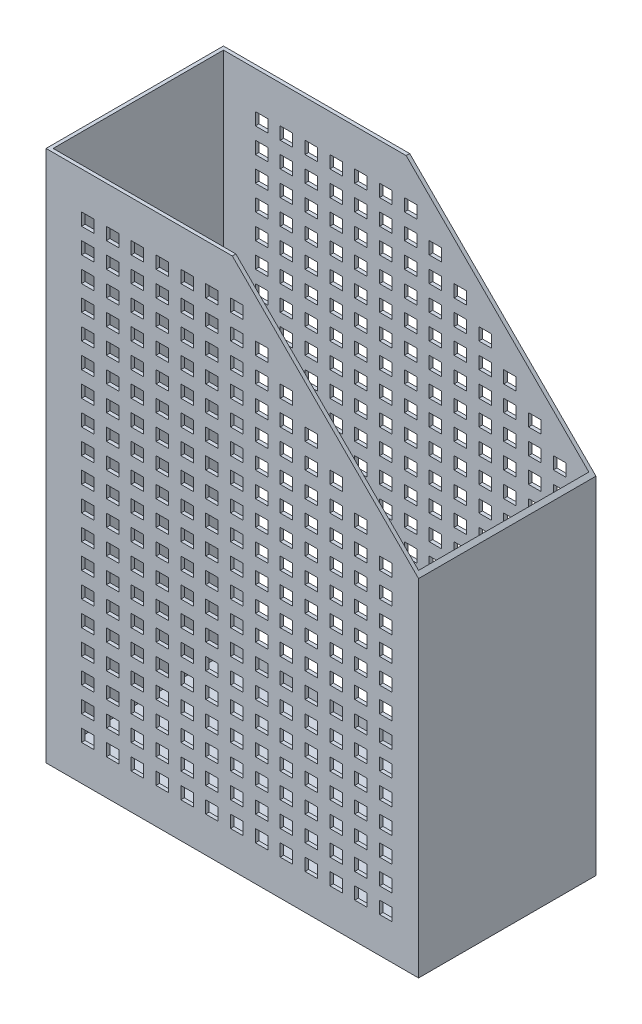
from build123d import *

# Parameters (mm, degrees)
SKETCH1_W                 = 210
SKETCH1_H                 = 100
BOSS_EXTRUDE1_DEPTH       = 300
CUT_EXTRUDE1_DEPTH        = 300
SHELL1_T                  = -2
SHELL1_THICKNESS_2_FACE_W = 96
SHELL1_THICKNESS_2_FACE_H = 206
SHELL1_THICKNESS_2_DEPTH  = 3
SKETCH3_W                 = 7
SKETCH3_H                 = 7
CUT_EXTRUDE3_DEPTH        = 300


with BuildPart() as part:
    # Sketch1 → Boss-Extrude1 (new body)
    with BuildSketch(Plane(origin=(0, 0, 0), x_dir=(1, 0, 0), z_dir=(0, 1, 0))):
        with Locations((105, 50)):
            Rectangle(SKETCH1_W, SKETCH1_H)
    extrude(amount=BOSS_EXTRUDE1_DEPTH)

    # Sketch2 → Cut-Extrude1 (cut)
    with BuildSketch(Plane.XY):
        Polygon((210, 300), (105, 300), (210, 195), align=None)
    extrude(amount=-CUT_EXTRUDE1_DEPTH, mode=Mode.SUBTRACT)

    # Shell1
    shell1_openings = [part.faces().sort_by_distance(p)[0] for p in [
        (52.5, 300, -50),
        (157.5, 247.5, -50),
    ]]
    offset(amount=SHELL1_T, openings=shell1_openings, kind=Kind.INTERSECTION)

    # Shell1 thickness 2 face (on inner face of the shell) → Shell1 thickness 2 (add)
    with BuildSketch(Plane(origin=(105, 2, -50), x_dir=(0, 0, -1), z_dir=(0, -1, 0))):
        Rectangle(SHELL1_THICKNESS_2_FACE_W, SHELL1_THICKNESS_2_FACE_H)
    extrude(amount=-SHELL1_THICKNESS_2_DEPTH)

    # Sketch3 → Cut-Extrude3 (cut)
    with BuildSketch(Plane.XY):
        with Locations((23.5, 23.5)):
            Rectangle(SKETCH3_W, SKETCH3_H)
        with Locations((37.5, 23.5)):
            Rectangle(SKETCH3_W, SKETCH3_H)
        with Locations((51.5, 23.5)):
            Rectangle(SKETCH3_W, SKETCH3_H)
        with Locations((65.5, 23.5)):
            Rectangle(SKETCH3_W, SKETCH3_H)
        with Locations((79.5, 23.5)):
            Rectangle(SKETCH3_W, SKETCH3_H)
        with Locations((93.5, 23.5)):
            Rectangle(SKETCH3_W, SKETCH3_H)
        with Locations((107.5, 23.5)):
            Rectangle(SKETCH3_W, SKETCH3_H)
        with Locations((121.5, 23.5)):
            Rectangle(SKETCH3_W, SKETCH3_H)
        with Locations((135.5, 23.5)):
            Rectangle(SKETCH3_W, SKETCH3_H)
        with Locations((149.5, 23.5)):
            Rectangle(SKETCH3_W, SKETCH3_H)
        with Locations((163.5, 23.5)):
            Rectangle(SKETCH3_W, SKETCH3_H)
        with Locations((177.5, 23.5)):
            Rectangle(SKETCH3_W, SKETCH3_H)
        with Locations((191.5, 23.5)):
            Rectangle(SKETCH3_W, SKETCH3_H)
        with Locations((37.5, 37.5)):
            Rectangle(SKETCH3_W, SKETCH3_H)
        with Locations((51.5, 37.5)):
            Rectangle(SKETCH3_W, SKETCH3_H)
        with Locations((65.5, 37.5)):
            Rectangle(SKETCH3_W, SKETCH3_H)
        with Locations((79.5, 37.5)):
            Rectangle(SKETCH3_W, SKETCH3_H)
        with Locations((93.5, 37.5)):
            Rectangle(SKETCH3_W, SKETCH3_H)
        with Locations((107.5, 37.5)):
            Rectangle(SKETCH3_W, SKETCH3_H)
        with Locations((121.5, 37.5)):
            Rectangle(SKETCH3_W, SKETCH3_H)
        with Locations((135.5, 37.5)):
            Rectangle(SKETCH3_W, SKETCH3_H)
        with Locations((149.5, 37.5)):
            Rectangle(SKETCH3_W, SKETCH3_H)
        with Locations((163.5, 37.5)):
            Rectangle(SKETCH3_W, SKETCH3_H)
        with Locations((177.5, 37.5)):
            Rectangle(SKETCH3_W, SKETCH3_H)
        with Locations((191.5, 37.5)):
            Rectangle(SKETCH3_W, SKETCH3_H)
        with Locations((37.5, 51.5)):
            Rectangle(SKETCH3_W, SKETCH3_H)
        with Locations((51.5, 51.5)):
            Rectangle(SKETCH3_W, SKETCH3_H)
        with Locations((65.5, 51.5)):
            Rectangle(SKETCH3_W, SKETCH3_H)
        with Locations((79.5, 51.5)):
            Rectangle(SKETCH3_W, SKETCH3_H)
        with Locations((93.5, 51.5)):
            Rectangle(SKETCH3_W, SKETCH3_H)
        with Locations((107.5, 51.5)):
            Rectangle(SKETCH3_W, SKETCH3_H)
        with Locations((121.5, 51.5)):
            Rectangle(SKETCH3_W, SKETCH3_H)
        with Locations((135.5, 51.5)):
            Rectangle(SKETCH3_W, SKETCH3_H)
        with Locations((149.5, 51.5)):
            Rectangle(SKETCH3_W, SKETCH3_H)
        with Locations((163.5, 51.5)):
            Rectangle(SKETCH3_W, SKETCH3_H)
        with Locations((177.5, 51.5)):
            Rectangle(SKETCH3_W, SKETCH3_H)
        with Locations((191.5, 51.5)):
            Rectangle(SKETCH3_W, SKETCH3_H)
        with Locations((37.5, 65.5)):
            Rectangle(SKETCH3_W, SKETCH3_H)
        with Locations((51.5, 65.5)):
            Rectangle(SKETCH3_W, SKETCH3_H)
        with Locations((65.5, 65.5)):
            Rectangle(SKETCH3_W, SKETCH3_H)
        with Locations((79.5, 65.5)):
            Rectangle(SKETCH3_W, SKETCH3_H)
        with Locations((93.5, 65.5)):
            Rectangle(SKETCH3_W, SKETCH3_H)
        with Locations((107.5, 65.5)):
            Rectangle(SKETCH3_W, SKETCH3_H)
        with Locations((121.5, 65.5)):
            Rectangle(SKETCH3_W, SKETCH3_H)
        with Locations((135.5, 65.5)):
            Rectangle(SKETCH3_W, SKETCH3_H)
        with Locations((149.5, 65.5)):
            Rectangle(SKETCH3_W, SKETCH3_H)
        with Locations((163.5, 65.5)):
            Rectangle(SKETCH3_W, SKETCH3_H)
        with Locations((177.5, 65.5)):
            Rectangle(SKETCH3_W, SKETCH3_H)
        with Locations((191.5, 65.5)):
            Rectangle(SKETCH3_W, SKETCH3_H)
        with Locations((37.5, 79.5)):
            Rectangle(SKETCH3_W, SKETCH3_H)
        with Locations((51.5, 79.5)):
            Rectangle(SKETCH3_W, SKETCH3_H)
        with Locations((65.5, 79.5)):
            Rectangle(SKETCH3_W, SKETCH3_H)
        with Locations((79.5, 79.5)):
            Rectangle(SKETCH3_W, SKETCH3_H)
        with Locations((93.5, 79.5)):
            Rectangle(SKETCH3_W, SKETCH3_H)
        with Locations((107.5, 79.5)):
            Rectangle(SKETCH3_W, SKETCH3_H)
        with Locations((121.5, 79.5)):
            Rectangle(SKETCH3_W, SKETCH3_H)
        with Locations((135.5, 79.5)):
            Rectangle(SKETCH3_W, SKETCH3_H)
        with Locations((149.5, 79.5)):
            Rectangle(SKETCH3_W, SKETCH3_H)
        with Locations((163.5, 79.5)):
            Rectangle(SKETCH3_W, SKETCH3_H)
        with Locations((177.5, 79.5)):
            Rectangle(SKETCH3_W, SKETCH3_H)
        with Locations((191.5, 79.5)):
            Rectangle(SKETCH3_W, SKETCH3_H)
        with Locations((37.5, 93.5)):
            Rectangle(SKETCH3_W, SKETCH3_H)
        with Locations((51.5, 93.5)):
            Rectangle(SKETCH3_W, SKETCH3_H)
        with Locations((65.5, 93.5)):
            Rectangle(SKETCH3_W, SKETCH3_H)
        with Locations((79.5, 93.5)):
            Rectangle(SKETCH3_W, SKETCH3_H)
        with Locations((93.5, 93.5)):
            Rectangle(SKETCH3_W, SKETCH3_H)
        with Locations((107.5, 93.5)):
            Rectangle(SKETCH3_W, SKETCH3_H)
        with Locations((121.5, 93.5)):
            Rectangle(SKETCH3_W, SKETCH3_H)
        with Locations((135.5, 93.5)):
            Rectangle(SKETCH3_W, SKETCH3_H)
        with Locations((149.5, 93.5)):
            Rectangle(SKETCH3_W, SKETCH3_H)
        with Locations((163.5, 93.5)):
            Rectangle(SKETCH3_W, SKETCH3_H)
        with Locations((177.5, 93.5)):
            Rectangle(SKETCH3_W, SKETCH3_H)
        with Locations((191.5, 93.5)):
            Rectangle(SKETCH3_W, SKETCH3_H)
        with Locations((37.5, 107.5)):
            Rectangle(SKETCH3_W, SKETCH3_H)
        with Locations((51.5, 107.5)):
            Rectangle(SKETCH3_W, SKETCH3_H)
        with Locations((65.5, 107.5)):
            Rectangle(SKETCH3_W, SKETCH3_H)
        with Locations((79.5, 107.5)):
            Rectangle(SKETCH3_W, SKETCH3_H)
        with Locations((93.5, 107.5)):
            Rectangle(SKETCH3_W, SKETCH3_H)
        with Locations((107.5, 107.5)):
            Rectangle(SKETCH3_W, SKETCH3_H)
        with Locations((121.5, 107.5)):
            Rectangle(SKETCH3_W, SKETCH3_H)
        with Locations((135.5, 107.5)):
            Rectangle(SKETCH3_W, SKETCH3_H)
        with Locations((149.5, 107.5)):
            Rectangle(SKETCH3_W, SKETCH3_H)
        with Locations((163.5, 107.5)):
            Rectangle(SKETCH3_W, SKETCH3_H)
        with Locations((177.5, 107.5)):
            Rectangle(SKETCH3_W, SKETCH3_H)
        with Locations((191.5, 107.5)):
            Rectangle(SKETCH3_W, SKETCH3_H)
        with Locations((37.5, 121.5)):
            Rectangle(SKETCH3_W, SKETCH3_H)
        with Locations((51.5, 121.5)):
            Rectangle(SKETCH3_W, SKETCH3_H)
        with Locations((65.5, 121.5)):
            Rectangle(SKETCH3_W, SKETCH3_H)
        with Locations((79.5, 121.5)):
            Rectangle(SKETCH3_W, SKETCH3_H)
        with Locations((93.5, 121.5)):
            Rectangle(SKETCH3_W, SKETCH3_H)
        with Locations((107.5, 121.5)):
            Rectangle(SKETCH3_W, SKETCH3_H)
        with Locations((121.5, 121.5)):
            Rectangle(SKETCH3_W, SKETCH3_H)
        with Locations((135.5, 121.5)):
            Rectangle(SKETCH3_W, SKETCH3_H)
        with Locations((149.5, 121.5)):
            Rectangle(SKETCH3_W, SKETCH3_H)
        with Locations((163.5, 121.5)):
            Rectangle(SKETCH3_W, SKETCH3_H)
        with Locations((177.5, 121.5)):
            Rectangle(SKETCH3_W, SKETCH3_H)
        with Locations((191.5, 121.5)):
            Rectangle(SKETCH3_W, SKETCH3_H)
        with Locations((37.5, 135.5)):
            Rectangle(SKETCH3_W, SKETCH3_H)
        with Locations((51.5, 135.5)):
            Rectangle(SKETCH3_W, SKETCH3_H)
        with Locations((65.5, 135.5)):
            Rectangle(SKETCH3_W, SKETCH3_H)
        with Locations((79.5, 135.5)):
            Rectangle(SKETCH3_W, SKETCH3_H)
        with Locations((93.5, 135.5)):
            Rectangle(SKETCH3_W, SKETCH3_H)
        with Locations((107.5, 135.5)):
            Rectangle(SKETCH3_W, SKETCH3_H)
        with Locations((121.5, 135.5)):
            Rectangle(SKETCH3_W, SKETCH3_H)
        with Locations((135.5, 135.5)):
            Rectangle(SKETCH3_W, SKETCH3_H)
        with Locations((149.5, 135.5)):
            Rectangle(SKETCH3_W, SKETCH3_H)
        with Locations((163.5, 135.5)):
            Rectangle(SKETCH3_W, SKETCH3_H)
        with Locations((177.5, 135.5)):
            Rectangle(SKETCH3_W, SKETCH3_H)
        with Locations((191.5, 135.5)):
            Rectangle(SKETCH3_W, SKETCH3_H)
        with Locations((37.5, 149.5)):
            Rectangle(SKETCH3_W, SKETCH3_H)
        with Locations((51.5, 149.5)):
            Rectangle(SKETCH3_W, SKETCH3_H)
        with Locations((65.5, 149.5)):
            Rectangle(SKETCH3_W, SKETCH3_H)
        with Locations((79.5, 149.5)):
            Rectangle(SKETCH3_W, SKETCH3_H)
        with Locations((93.5, 149.5)):
            Rectangle(SKETCH3_W, SKETCH3_H)
        with Locations((107.5, 149.5)):
            Rectangle(SKETCH3_W, SKETCH3_H)
        with Locations((121.5, 149.5)):
            Rectangle(SKETCH3_W, SKETCH3_H)
        with Locations((135.5, 149.5)):
            Rectangle(SKETCH3_W, SKETCH3_H)
        with Locations((149.5, 149.5)):
            Rectangle(SKETCH3_W, SKETCH3_H)
        with Locations((163.5, 149.5)):
            Rectangle(SKETCH3_W, SKETCH3_H)
        with Locations((177.5, 149.5)):
            Rectangle(SKETCH3_W, SKETCH3_H)
        with Locations((191.5, 149.5)):
            Rectangle(SKETCH3_W, SKETCH3_H)
        with Locations((37.5, 163.5)):
            Rectangle(SKETCH3_W, SKETCH3_H)
        with Locations((51.5, 163.5)):
            Rectangle(SKETCH3_W, SKETCH3_H)
        with Locations((65.5, 163.5)):
            Rectangle(SKETCH3_W, SKETCH3_H)
        with Locations((79.5, 163.5)):
            Rectangle(SKETCH3_W, SKETCH3_H)
        with Locations((93.5, 163.5)):
            Rectangle(SKETCH3_W, SKETCH3_H)
        with Locations((107.5, 163.5)):
            Rectangle(SKETCH3_W, SKETCH3_H)
        with Locations((121.5, 163.5)):
            Rectangle(SKETCH3_W, SKETCH3_H)
        with Locations((135.5, 163.5)):
            Rectangle(SKETCH3_W, SKETCH3_H)
        with Locations((149.5, 163.5)):
            Rectangle(SKETCH3_W, SKETCH3_H)
        with Locations((163.5, 163.5)):
            Rectangle(SKETCH3_W, SKETCH3_H)
        with Locations((177.5, 163.5)):
            Rectangle(SKETCH3_W, SKETCH3_H)
        with Locations((191.5, 163.5)):
            Rectangle(SKETCH3_W, SKETCH3_H)
        with Locations((37.5, 177.5)):
            Rectangle(SKETCH3_W, SKETCH3_H)
        with Locations((51.5, 177.5)):
            Rectangle(SKETCH3_W, SKETCH3_H)
        with Locations((65.5, 177.5)):
            Rectangle(SKETCH3_W, SKETCH3_H)
        with Locations((79.5, 177.5)):
            Rectangle(SKETCH3_W, SKETCH3_H)
        with Locations((93.5, 177.5)):
            Rectangle(SKETCH3_W, SKETCH3_H)
        with Locations((107.5, 177.5)):
            Rectangle(SKETCH3_W, SKETCH3_H)
        with Locations((121.5, 177.5)):
            Rectangle(SKETCH3_W, SKETCH3_H)
        with Locations((135.5, 177.5)):
            Rectangle(SKETCH3_W, SKETCH3_H)
        with Locations((149.5, 177.5)):
            Rectangle(SKETCH3_W, SKETCH3_H)
        with Locations((163.5, 177.5)):
            Rectangle(SKETCH3_W, SKETCH3_H)
        with Locations((177.5, 177.5)):
            Rectangle(SKETCH3_W, SKETCH3_H)
        with Locations((191.5, 177.5)):
            Rectangle(SKETCH3_W, SKETCH3_H)
        with Locations((37.5, 191.5)):
            Rectangle(SKETCH3_W, SKETCH3_H)
        with Locations((51.5, 191.5)):
            Rectangle(SKETCH3_W, SKETCH3_H)
        with Locations((65.5, 191.5)):
            Rectangle(SKETCH3_W, SKETCH3_H)
        with Locations((79.5, 191.5)):
            Rectangle(SKETCH3_W, SKETCH3_H)
        with Locations((93.5, 191.5)):
            Rectangle(SKETCH3_W, SKETCH3_H)
        with Locations((107.5, 191.5)):
            Rectangle(SKETCH3_W, SKETCH3_H)
        with Locations((121.5, 191.5)):
            Rectangle(SKETCH3_W, SKETCH3_H)
        with Locations((135.5, 191.5)):
            Rectangle(SKETCH3_W, SKETCH3_H)
        with Locations((149.5, 191.5)):
            Rectangle(SKETCH3_W, SKETCH3_H)
        with Locations((163.5, 191.5)):
            Rectangle(SKETCH3_W, SKETCH3_H)
        with Locations((177.5, 191.5)):
            Rectangle(SKETCH3_W, SKETCH3_H)
        with Locations((191.5, 191.5)):
            Rectangle(SKETCH3_W, SKETCH3_H)
        with Locations((37.5, 205.5)):
            Rectangle(SKETCH3_W, SKETCH3_H)
        with Locations((51.5, 205.5)):
            Rectangle(SKETCH3_W, SKETCH3_H)
        with Locations((65.5, 205.5)):
            Rectangle(SKETCH3_W, SKETCH3_H)
        with Locations((79.5, 205.5)):
            Rectangle(SKETCH3_W, SKETCH3_H)
        with Locations((93.5, 205.5)):
            Rectangle(SKETCH3_W, SKETCH3_H)
        with Locations((107.5, 205.5)):
            Rectangle(SKETCH3_W, SKETCH3_H)
        with Locations((121.5, 205.5)):
            Rectangle(SKETCH3_W, SKETCH3_H)
        with Locations((135.5, 205.5)):
            Rectangle(SKETCH3_W, SKETCH3_H)
        with Locations((149.5, 205.5)):
            Rectangle(SKETCH3_W, SKETCH3_H)
        with Locations((163.5, 205.5)):
            Rectangle(SKETCH3_W, SKETCH3_H)
        with Locations((177.5, 205.5)):
            Rectangle(SKETCH3_W, SKETCH3_H)
        with Locations((37.5, 219.5)):
            Rectangle(SKETCH3_W, SKETCH3_H)
        with Locations((51.5, 219.5)):
            Rectangle(SKETCH3_W, SKETCH3_H)
        with Locations((65.5, 219.5)):
            Rectangle(SKETCH3_W, SKETCH3_H)
        with Locations((79.5, 219.5)):
            Rectangle(SKETCH3_W, SKETCH3_H)
        with Locations((93.5, 219.5)):
            Rectangle(SKETCH3_W, SKETCH3_H)
        with Locations((107.5, 219.5)):
            Rectangle(SKETCH3_W, SKETCH3_H)
        with Locations((121.5, 219.5)):
            Rectangle(SKETCH3_W, SKETCH3_H)
        with Locations((135.5, 219.5)):
            Rectangle(SKETCH3_W, SKETCH3_H)
        with Locations((149.5, 219.5)):
            Rectangle(SKETCH3_W, SKETCH3_H)
        with Locations((163.5, 219.5)):
            Rectangle(SKETCH3_W, SKETCH3_H)
        with Locations((37.5, 233.5)):
            Rectangle(SKETCH3_W, SKETCH3_H)
        with Locations((51.5, 233.5)):
            Rectangle(SKETCH3_W, SKETCH3_H)
        with Locations((65.5, 233.5)):
            Rectangle(SKETCH3_W, SKETCH3_H)
        with Locations((79.5, 233.5)):
            Rectangle(SKETCH3_W, SKETCH3_H)
        with Locations((93.5, 233.5)):
            Rectangle(SKETCH3_W, SKETCH3_H)
        with Locations((107.5, 233.5)):
            Rectangle(SKETCH3_W, SKETCH3_H)
        with Locations((121.5, 233.5)):
            Rectangle(SKETCH3_W, SKETCH3_H)
        with Locations((135.5, 233.5)):
            Rectangle(SKETCH3_W, SKETCH3_H)
        with Locations((149.5, 233.5)):
            Rectangle(SKETCH3_W, SKETCH3_H)
        with Locations((191.5, 233.5)):
            Rectangle(SKETCH3_W, SKETCH3_H)
        with Locations((37.5, 247.5)):
            Rectangle(SKETCH3_W, SKETCH3_H)
        with Locations((51.5, 247.5)):
            Rectangle(SKETCH3_W, SKETCH3_H)
        with Locations((65.5, 247.5)):
            Rectangle(SKETCH3_W, SKETCH3_H)
        with Locations((79.5, 247.5)):
            Rectangle(SKETCH3_W, SKETCH3_H)
        with Locations((93.5, 247.5)):
            Rectangle(SKETCH3_W, SKETCH3_H)
        with Locations((107.5, 247.5)):
            Rectangle(SKETCH3_W, SKETCH3_H)
        with Locations((121.5, 247.5)):
            Rectangle(SKETCH3_W, SKETCH3_H)
        with Locations((135.5, 247.5)):
            Rectangle(SKETCH3_W, SKETCH3_H)
        with Locations((177.5, 247.5)):
            Rectangle(SKETCH3_W, SKETCH3_H)
        with Locations((191.5, 247.5)):
            Rectangle(SKETCH3_W, SKETCH3_H)
        with Locations((37.5, 261.5)):
            Rectangle(SKETCH3_W, SKETCH3_H)
        with Locations((51.5, 261.5)):
            Rectangle(SKETCH3_W, SKETCH3_H)
        with Locations((65.5, 261.5)):
            Rectangle(SKETCH3_W, SKETCH3_H)
        with Locations((79.5, 261.5)):
            Rectangle(SKETCH3_W, SKETCH3_H)
        with Locations((93.5, 261.5)):
            Rectangle(SKETCH3_W, SKETCH3_H)
        with Locations((107.5, 261.5)):
            Rectangle(SKETCH3_W, SKETCH3_H)
        with Locations((121.5, 261.5)):
            Rectangle(SKETCH3_W, SKETCH3_H)
        with Locations((163.5, 261.5)):
            Rectangle(SKETCH3_W, SKETCH3_H)
        with Locations((177.5, 261.5)):
            Rectangle(SKETCH3_W, SKETCH3_H)
        with Locations((191.5, 261.5)):
            Rectangle(SKETCH3_W, SKETCH3_H)
        with Locations((37.5, 275.5)):
            Rectangle(SKETCH3_W, SKETCH3_H)
        with Locations((51.5, 275.5)):
            Rectangle(SKETCH3_W, SKETCH3_H)
        with Locations((65.5, 275.5)):
            Rectangle(SKETCH3_W, SKETCH3_H)
        with Locations((79.5, 275.5)):
            Rectangle(SKETCH3_W, SKETCH3_H)
        with Locations((93.5, 275.5)):
            Rectangle(SKETCH3_W, SKETCH3_H)
        with Locations((107.5, 275.5)):
            Rectangle(SKETCH3_W, SKETCH3_H)
        with Locations((149.5, 275.5)):
            Rectangle(SKETCH3_W, SKETCH3_H)
        with Locations((163.5, 275.5)):
            Rectangle(SKETCH3_W, SKETCH3_H)
        with Locations((177.5, 275.5)):
            Rectangle(SKETCH3_W, SKETCH3_H)
        with Locations((191.5, 275.5)):
            Rectangle(SKETCH3_W, SKETCH3_H)
        with Locations((23.5, 37.5)):
            Rectangle(SKETCH3_W, SKETCH3_H)
        with Locations((23.5, 51.5)):
            Rectangle(SKETCH3_W, SKETCH3_H)
        with Locations((23.5, 65.5)):
            Rectangle(SKETCH3_W, SKETCH3_H)
        with Locations((23.5, 79.5)):
            Rectangle(SKETCH3_W, SKETCH3_H)
        with Locations((23.5, 93.5)):
            Rectangle(SKETCH3_W, SKETCH3_H)
        with Locations((23.5, 107.5)):
            Rectangle(SKETCH3_W, SKETCH3_H)
        with Locations((23.5, 121.5)):
            Rectangle(SKETCH3_W, SKETCH3_H)
        with Locations((23.5, 135.5)):
            Rectangle(SKETCH3_W, SKETCH3_H)
        with Locations((23.5, 149.5)):
            Rectangle(SKETCH3_W, SKETCH3_H)
        with Locations((23.5, 163.5)):
            Rectangle(SKETCH3_W, SKETCH3_H)
        with Locations((23.5, 177.5)):
            Rectangle(SKETCH3_W, SKETCH3_H)
        with Locations((23.5, 191.5)):
            Rectangle(SKETCH3_W, SKETCH3_H)
        with Locations((23.5, 205.5)):
            Rectangle(SKETCH3_W, SKETCH3_H)
        with Locations((23.5, 219.5)):
            Rectangle(SKETCH3_W, SKETCH3_H)
        with Locations((23.5, 233.5)):
            Rectangle(SKETCH3_W, SKETCH3_H)
        with Locations((23.5, 247.5)):
            Rectangle(SKETCH3_W, SKETCH3_H)
        with Locations((23.5, 261.5)):
            Rectangle(SKETCH3_W, SKETCH3_H)
        with Locations((23.5, 275.5)):
            Rectangle(SKETCH3_W, SKETCH3_H)
    extrude(amount=-CUT_EXTRUDE3_DEPTH, mode=Mode.SUBTRACT)


solid = part.part
